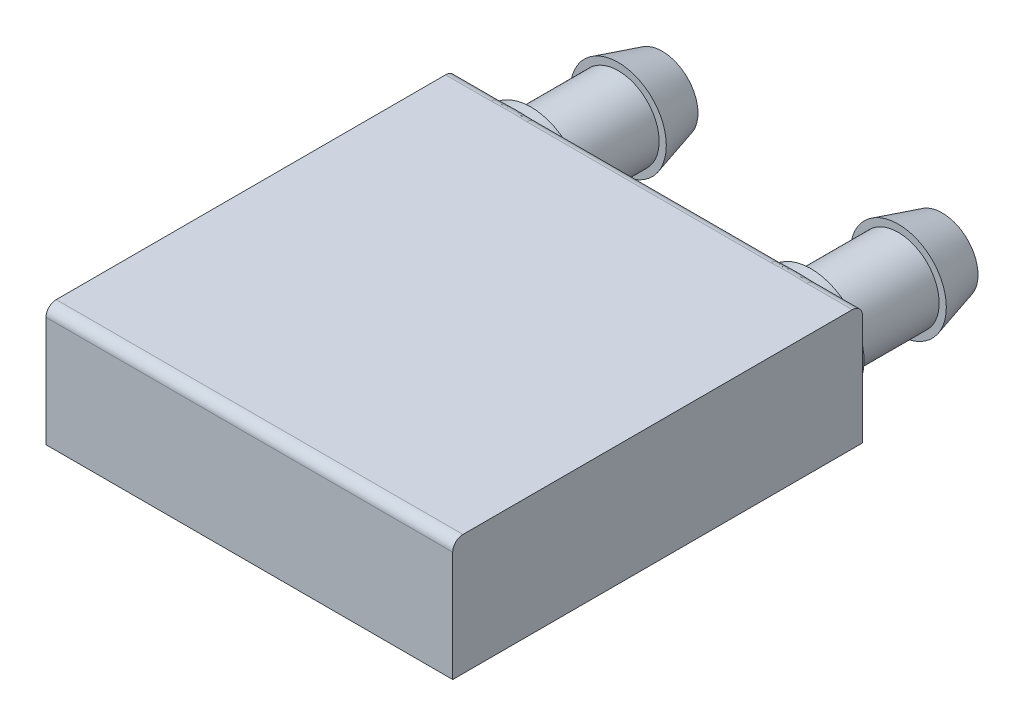
from build123d import *

# Parameters (mm, degrees)
SKETCH1_W           = 39.8
SKETCH1_H           = 40.1
BOSS_EXTRUDE1_DEPTH = 11.8
SKETCH2_R           = 5.2
BOSS_EXTRUDE2_DEPTH = 1.15
SKETCH3_R           = 4
BOSS_EXTRUDE3_DEPTH = 8.55
SKETCH4_W           = 1.985131543
SKETCH4_H           = 1.538416695
BOSS_EXTRUDE4_DEPTH = 1
SKETCH10_W          = 1.450314217
SKETCH10_H          = 0.967398797
BOSS_EXTRUDE5_DEPTH = 1
SKETCH12_R          = 3.15
CUT_EXTRUDE1_DEPTH  = 15
FILLET1_R           = 1


with BuildPart() as part:
    # Sketch1 → Boss-Extrude1 (new body)
    with BuildSketch(Plane(origin=(0, 0, 0), x_dir=(1, 0, 0), z_dir=(0, 1, 0))):
        with Locations((19.9, 20.05)):
            Rectangle(SKETCH1_W, SKETCH1_H)
    extrude(amount=BOSS_EXTRUDE1_DEPTH)

    # Sketch2 → Boss-Extrude2 (add)
    with BuildSketch(Plane(origin=(0, 0, -40.1), x_dir=(-1, 0, 0), z_dir=(0, 0, -1))):
        with Locations((-6.2, 5.9)):
            Circle(SKETCH2_R)
        with Locations((-33.6, 5.9)):
            Circle(SKETCH2_R)
    extrude(amount=BOSS_EXTRUDE2_DEPTH)

    # Sketch3 → Boss-Extrude3 (add)
    with BuildSketch(Plane(origin=(0, 0, -41.25), x_dir=(-1, 0, 0), z_dir=(0, 0, -1))):
        with Locations((-33.6, 5.9)):
            Circle(SKETCH3_R)
        with Locations((-6.2, 5.9)):
            Circle(SKETCH3_R)
    extrude(amount=BOSS_EXTRUDE3_DEPTH)

    # Sketch4 → Boss-Extrude4 (add)
    with BuildSketch(Plane(origin=(0, 0, -49.8), x_dir=(-1, 0, 0), z_dir=(0, 0, -1))):
        with Locations((-7.192565771, 5.130791653)):
            Rectangle(SKETCH4_W, SKETCH4_H)
    extrude(amount=BOSS_EXTRUDE4_DEPTH)

    # Sketch7 → Revolve2 (revolve)
    with BuildSketch(Plane(origin=(0, 5.9, 0), x_dir=(1, 0, 0), z_dir=(0, 1, 0))):
        Polygon((6.2, 49.8), (10.9, 49.8), (9.7, 54.1), (6.2, 54.1), align=None)
    revolve(axis=Axis((6.2, 5.9, -49.8), (0, 0, -1)))

    # Sketch10 → Boss-Extrude5 (add)
    with BuildSketch(Plane(origin=(0, 0, -49.8), x_dir=(-1, 0, 0), z_dir=(0, 0, -1))):
        with Locations((-34.325157109, 5.416300601)):
            Rectangle(SKETCH10_W, SKETCH10_H)
    extrude(amount=BOSS_EXTRUDE5_DEPTH)

    # Sketch11 → Revolve4 (revolve)
    with BuildSketch(Plane(origin=(0, 5.9, 0), x_dir=(1, 0, 0), z_dir=(0, 1, 0))):
        Polygon((33.6, 49.8), (28.9, 49.8), (30.1, 54.1), (33.6, 54.1), align=None)
    revolve(axis=Axis((33.6, 5.9, -49.8), (0, 0, -1)))

    # Sketch12 → Cut-Extrude1 (cut)
    with BuildSketch(Plane(origin=(0, 0, -54.1), x_dir=(-1, 0, 0), z_dir=(0, 0, -1))):
        with Locations((-6.2, 5.9)):
            Circle(SKETCH12_R)
        with Locations((-33.6, 5.9)):
            Circle(SKETCH12_R)
    extrude(amount=-CUT_EXTRUDE1_DEPTH, mode=Mode.SUBTRACT)

    # Fillet1
    fillet1_edges = [part.edges().sort_by_distance(p)[0] for p in [
        (19.9, 11.8, 0),
        (19.9, 11.8, -40.1),
    ]]
    fillet(fillet1_edges, radius=FILLET1_R)


solid = part.part
